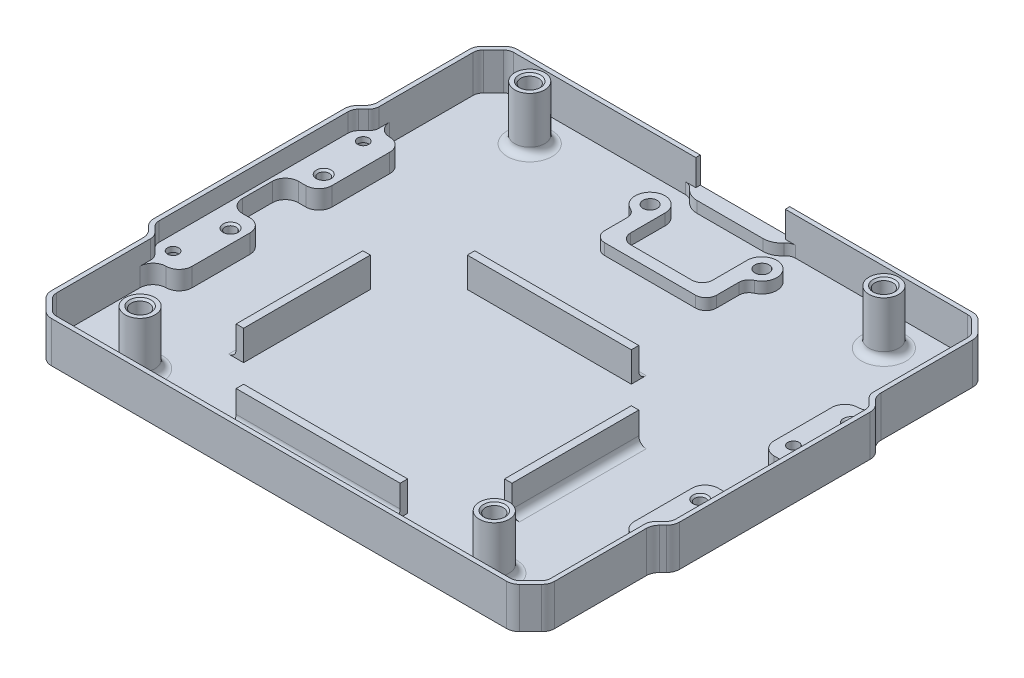
from build123d import *

# Parameters (mm, degrees)
EXTRUDE_1_DEPTH      = 1
SKETCH_2_W           = 24
SKETCH_2_H           = 4
EXTRUDE_2_DEPTH      = 3
SKETCH_5_W           = 74
SKETCH_5_H           = 64
SKETCH_5_W_2         = 70
SKETCH_5_H_2         = 60
EXTRUDE_3_DEPTH      = 8
SKETCH_33_W          = 15
SKETCH_33_H          = 15
CUT_EXTRUDE_12_DEPTH = 8
EXTRUDE_4_DEPTH      = 10
EXTRUDE_6_DEPTH      = 5
FILLET_1_R           = 3.5
FILLET_5_R           = 2.8
FILLET_7_R           = 5
SKETCH_9_R           = 4
EXTRUDE_7_DEPTH      = 14.5
SKETCH_3_R           = 1.9
CUT_EXTRUDE_1_DEPTH  = 4
SKETCH_10_R          = 2.4
CUT_EXTRUDE_3_DEPTH  = 4.5
SKETCH_11_R          = 2.15
CUT_EXTRUDE_4_DEPTH  = 9
SKETCH_12_R          = 1.5
CUT_EXTRUDE_8_DEPTH  = 10
SKETCH_14_R          = 2.5
CUT_EXTRUDE_7_DEPTH  = 4.6
SKETCH_13_R          = 1.5
CUT_EXTRUDE_10_DEPTH = 6
FILLET_4_R           = 2
CHAMFER_2_SIZE       = 0.5


# Read off the part's stored shape, not the designer's step: 凸台-拉伸6
with BuildPart() as part:
    # 草图1 → 凸台-拉伸1 (new body)
    with BuildSketch(Plane(origin=(0, 0, 0), x_dir=(1, 0, 0), z_dir=(0, 1, 0))):
        Polygon((-67.5, 57.5), (-62.5, 62.5), (62.5, 62.5), (67.5, 57.5), (67.5, 30), (70.5, 27), (70.5, -27), (67.5, -30), (67.5, -57.5), (62.5, -62.5), (-62.5, -62.5), (-67.5, -57.5), (-67.5, -30), (-70.5, -27), (-70.5, 27), (-67.5, 30), align=None)
    extrude(amount=EXTRUDE_1_DEPTH)

    # 草图2 → 凸台-拉伸2 (add)
    with BuildSketch(Plane(origin=(0, 1, 0), x_dir=(1, 0, 0), z_dir=(0, 1, 0))):
        with BuildLine():
            Line((-14.25, 47.3), (-14.25, 36.3))
            Line((-14.25, 36.3), (15.75, 36.3))
            Line((15.75, 36.3), (15.75, 47.3))
            ThreePointArc((15.75, 47.3), (19.75, 51.3), (15.75, 55.3))
            ThreePointArc((15.75, 55.3), (12.921572875, 54.128427125), (11.75, 51.3))
            Line((11.75, 51.3), (11.75, 39.3))
            Line((11.75, 39.3), (-10.25, 39.3))
            Line((-10.25, 39.3), (-10.25, 51.3))
            ThreePointArc((-10.25, 51.3), (-11.421572875, 54.128427125), (-14.25, 55.3))
            ThreePointArc((-14.25, 55.3), (-18.25, 51.3), (-14.25, 47.3))
        make_face()
        with Locations((0, 60.5)):
            Rectangle(SKETCH_2_W, SKETCH_2_H)
    extrude(amount=EXTRUDE_2_DEPTH)

    # 草图5 → 凸台-拉伸3 (add)
    with BuildSketch(Plane(origin=(0, 1, 0), x_dir=(1, 0, 0), z_dir=(0, 1, 0))):
        with Locations((0, -20)):
            Rectangle(SKETCH_5_W, SKETCH_5_H)
        with Locations((0, -20)):
            Rectangle(SKETCH_5_W_2, SKETCH_5_H_2, mode=Mode.SUBTRACT)
    extrude(amount=EXTRUDE_3_DEPTH)

    # 草图33 → 切除-拉伸12 (cut)
    with BuildSketch(Plane(origin=(0, 9, 0), x_dir=(1, 0, 0), z_dir=(0, 1, 0))):
        with Locations((-29.5, 4.5)):
            Rectangle(SKETCH_33_W, SKETCH_33_H)
        with Locations((29.5, 4.5)):
            Rectangle(SKETCH_33_W, SKETCH_33_H)
        with Locations((29.5, -44.5)):
            Rectangle(SKETCH_33_W, SKETCH_33_H)
        with Locations((-29.5, -44.5)):
            Rectangle(SKETCH_33_W, SKETCH_33_H)
    extrude(amount=-CUT_EXTRUDE_12_DEPTH, mode=Mode.SUBTRACT)

    # 草图6 → 凸台-拉伸4 (add)
    with BuildSketch(Plane(origin=(0, 1, 0), x_dir=(1, 0, 0), z_dir=(0, 1, 0))):
        Polygon((-13.069686908, 61.3), (-62.002943725, 61.3), (-66.3, 57.002943725), (-66.3, 29.502943725), (-69.3, 26.502943725), (-69.3, -26.502943725), (-66.3, -29.502943725), (-66.3, -57.002943725), (-62.002943725, -61.3), (62.002943725, -61.3), (66.3, -57.002943725), (66.3, -29.502943725), (69.3, -26.502943725), (69.3, 26.502943725), (66.3, 29.502943725), (66.3, 57.002943725), (62.002943725, 61.3), (13.24, 61.3), (12, 61.3), (12, 62.5), (62.5, 62.5), (67.5, 57.5), (67.5, 30), (70.5, 27), (70.5, -27), (67.5, -30), (67.5, -57.5), (62.5, -62.5), (-62.5, -62.5), (-67.5, -57.5), (-67.5, -30), (-70.5, -27), (-70.5, 27), (-67.5, 30), (-67.5, 57.5), (-62.5, 62.5), (-12, 62.5), (-12, 61.3), align=None)
    extrude(amount=EXTRUDE_4_DEPTH)

    # 凸台-拉伸6 outline → 凸台-拉伸6 (add)
    with BuildSketch(Plane(origin=(0, 1, 0), x_dir=(1, 0, 0), z_dir=(0, 1, 0))):
        Polygon((59.3, 30), (59.3, 7.5), (68.3, 7.5), (68.3, -7.5), (59.3, -7.5), (59.3, -30), (66.3, -30), (66.3, -29.502943725), (69.3, -26.502943725), (69.3, 26.502943725), (66.3, 29.502943725), (66.3, 30), align=None)
        Polygon((-68.3, 7.5), (-59.3, 7.5), (-59.3, 30), (-66.3, 30), (-66.3, 29.502943725), (-69.3, 26.502943725), (-69.3, -26.502943725), (-66.3, -29.502943725), (-66.3, -30), (-59.3, -30), (-59.3, -7.5), (-68.3, -7.5), align=None)
    extrude(amount=EXTRUDE_6_DEPTH)

    # 圆角1
    fillet_1_edges = [part.edges().sort_by_distance(p)[0] for p in [
        (62.5, 5.5, -62.5),
        (67.5, 5.5, -57.5),
        (-62.5, 5.5, -62.5),
        (-67.5, 5.5, -57.5),
        (-67.5, 5.5, -30),
        (-70.5, 5.5, -27),
        (-62.5, 5.5, 62.5),
        (-67.5, 5.5, 57.5),
        (-70.5, 5.5, 27),
        (-67.5, 5.5, 30),
        (62.5, 5.5, 62.5),
        (67.5, 5.5, 57.5),
        (70.5, 5.5, 27),
        (67.5, 5.5, 30),
        (67.5, 5.5, -30),
        (70.5, 5.5, -27),
        (66.3, 3.5, -30),
        (59.3, 3.5, 30),
        (66.3, 3.5, 30),
        (-66.3, 3.5, -30),
        (-66.3, 3.5, 30),
        (-59.3, 3.5, 30),
        (-68.3, 3.5, 7.5),
        (-68.3, 3.5, -7.5),
        (68.3, 3.5, -7.5),
        (68.3, 3.5, 7.5),
        (59.3, 3.5, 7.5),
        (59.3, 3.5, -30),
        (59.3, 3.5, -7.5),
        (-59.3, 3.5, 7.5),
        (-59.3, 3.5, -7.5),
        (-59.3, 3.5, -30),
    ]]
    fillet(fillet_1_edges, radius=FILLET_1_R - 0.0001)  # a hair under: the kernel refuses the full size

    # 圆角5
    fillet_5_edges = [part.edges().sort_by_distance(p)[0] for p in [
        (15.75, 2.5, -36.3),
        (15.75, 2.5, -47.3),
        (-14.25, 2.5, -47.3),
        (-14.25, 2.5, -36.3),
        (12, 2.5, -61.3),
        (-12, 2.5, -61.3),
        (11.75, 2.5, -39.3),
        (-10.25, 2.5, -39.3),
        (69.3, 8.5, -26.502943725),
        (66.3, 8.5, -29.502943725),
        (66.3, 6, -57.002943725),
        (62.002943725, 6, -61.3),
        (69.3, 8.5, 26.502943725),
        (66.3, 8.5, 29.502943725),
        (62.002943725, 6, 61.3),
        (66.3, 6, 57.002943725),
        (-69.3, 8.5, 26.502943725),
        (-66.3, 8.5, 29.502943725),
        (-66.3, 6, 57.002943725),
        (-62.002943725, 6, 61.3),
        (-69.3, 8.5, -26.502943725),
        (-66.3, 8.5, -29.502943725),
        (-66.3, 6, -57.002943725),
        (-62.002943725, 6, -61.3),
    ]]
    fillet(fillet_5_edges, radius=FILLET_5_R - 0.0001)  # a hair under: the kernel refuses the full size

    # 圆角7
    fillet_7_edges = [part.edges().sort_by_distance(p)[0] for p in [
        (-12, 2.5, -58.5),
        (12, 2.5, -58.5),
    ]]
    fillet(fillet_7_edges, radius=FILLET_7_R)

    # 草图9 → 凸台-拉伸7 (add)
    with BuildSketch(Plane(origin=(0, 1, 0), x_dir=(1, 0, 0), z_dir=(0, 1, 0))):
        with Locations(Location((47.5, 52.25, 0), (0, 0, 90))):
            Circle(SKETCH_9_R)
        with Locations(Location((-47.5, 52.25, 0), (0, 0, 90))):
            Circle(SKETCH_9_R)
        with Locations(Location((-47.5, -52.25, 0), (0, 0, 90))):
            Circle(SKETCH_9_R)
        with Locations(Location((47.5, -52.25, 0), (0, 0, 90))):
            Circle(SKETCH_9_R)
    extrude(amount=EXTRUDE_7_DEPTH)

    # 草图3 → 切除-拉伸1 (cut)
    with BuildSketch(Plane(origin=(0, 4, 0), x_dir=(1, 0, 0), z_dir=(0, 1, 0))):
        with Locations(Location((-14.25, 51.3, 0), (0, 0, 270))):
            Circle(SKETCH_3_R)
        with Locations(Location((15.75, 51.3, 0), (0, 0, 270))):
            Circle(SKETCH_3_R)
    extrude(amount=-CUT_EXTRUDE_1_DEPTH, mode=Mode.SUBTRACT)

    # 草图10 → 切除-拉伸3 (cut)
    with BuildSketch(Plane(origin=(0, 15.5, 0), x_dir=(1, 0, 0), z_dir=(0, 1, 0))):
        with Locations(Location((-47.5, 52.25, 0), (0, 0, 270))):
            Circle(SKETCH_10_R)
        with Locations(Location((47.5, 52.25, 0), (0, 0, 270))):
            Circle(SKETCH_10_R)
        with Locations(Location((47.5, -52.25, 0), (0, 0, 270))):
            Circle(SKETCH_10_R)
        with Locations(Location((-47.5, -52.25, 0), (0, 0, 270))):
            Circle(SKETCH_10_R)
    extrude(amount=-CUT_EXTRUDE_3_DEPTH, mode=Mode.SUBTRACT)

    # 草图11 → 切除-拉伸4 (cut)
    with BuildSketch(Plane(origin=(0, 11, 0), x_dir=(1, 0, 0), z_dir=(0, 1, 0))):
        with Locations(Location((-47.5, -52.25, 0), (0, 0, 270))):
            Circle(SKETCH_11_R)
        with Locations(Location((47.5, -52.25, 0), (0, 0, 270))):
            Circle(SKETCH_11_R)
        with Locations(Location((47.5, 52.25, 0), (0, 0, 270))):
            Circle(SKETCH_11_R)
        with Locations(Location((-47.5, 52.25, 0), (0, 0, 270))):
            Circle(SKETCH_11_R)
    extrude(amount=-CUT_EXTRUDE_4_DEPTH, mode=Mode.SUBTRACT)

    # 草图12 → 切除-拉伸8 (cut)
    with BuildSketch(Plane(origin=(0, 6, 0), x_dir=(1, 0, 0), z_dir=(0, 1, 0))):
        with Locations(Location((65.4, 25.5, 0), (0, 0, 270))):
            Circle(SKETCH_12_R)
        with Locations(Location((65.4, -25.5, 0), (0, 0, 270))):
            Circle(SKETCH_12_R)
        with Locations(Location((-65.4, -25.5, 0), (0, 0, 270))):
            Circle(SKETCH_12_R)
        with Locations(Location((-65.4, 25.5, 0), (0, 0, 270))):
            Circle(SKETCH_12_R)
    extrude(amount=-CUT_EXTRUDE_8_DEPTH, mode=Mode.SUBTRACT)

    # 草图14 → 切除-拉伸7 (cut)
    with BuildSketch(Plane.XZ):
        with Locations(Location((-65.4, 25.5, 0), (0, 0, 270))):
            Circle(SKETCH_14_R)
        with Locations(Location((65.4, 25.5, 0), (0, 0, 270))):
            Circle(SKETCH_14_R)
        with Locations(Location((65.4, -25.5, 0), (0, 0, 270))):
            Circle(SKETCH_14_R)
        with Locations(Location((-65.4, -25.5, 0), (0, 0, 270))):
            Circle(SKETCH_14_R)
    extrude(amount=-CUT_EXTRUDE_7_DEPTH, mode=Mode.SUBTRACT)

    # 草图13 → 切除-拉伸10 (cut)
    with BuildSketch(Plane(origin=(0, 6, 0), x_dir=(1, 0, 0), z_dir=(0, 1, 0))):
        with Locations(Location((63, 12.5, 0), (0, 0, 270))):
            Circle(SKETCH_13_R)
        with Locations(Location((63, -12.5, 0), (0, 0, 270))):
            Circle(SKETCH_13_R)
        with Locations(Location((-63, -12.5, 0), (0, 0, 270))):
            Circle(SKETCH_13_R)
        with Locations(Location((-63, 12.5, 0), (0, 0, 270))):
            Circle(SKETCH_13_R)
    extrude(amount=-CUT_EXTRUDE_10_DEPTH, mode=Mode.SUBTRACT)

    # 圆角4
    fillet_4_edges = [part.edges().sort_by_distance(p)[0] for p in [
        (0, 1, 52),
        (-37, 1, 20),
        (0, 1, -12),
        (37, 1, 20),
        (47.5, 1, -48.25),
        (-47.5, 1, -48.25),
        (-47.5, 1, 56.25),
        (47.5, 1, 56.25),
    ]]
    fillet(fillet_4_edges, radius=FILLET_4_R)

    # 倒角2
    chamfer_2_edges = [part.edges().sort_by_distance(p)[0] for p in [
        (-47.5, 15.5, 49.85),
        (47.5, 15.5, 49.85),
        (47.5, 15.5, -54.65),
        (-47.5, 15.5, -54.65),
        (65.4, 6, -27),
        (-63, 6, -14),
        (-63, 6, 11),
        (63, 6, 11),
    ]]
    chamfer(chamfer_2_edges, length=CHAMFER_2_SIZE)


solid = part.part
